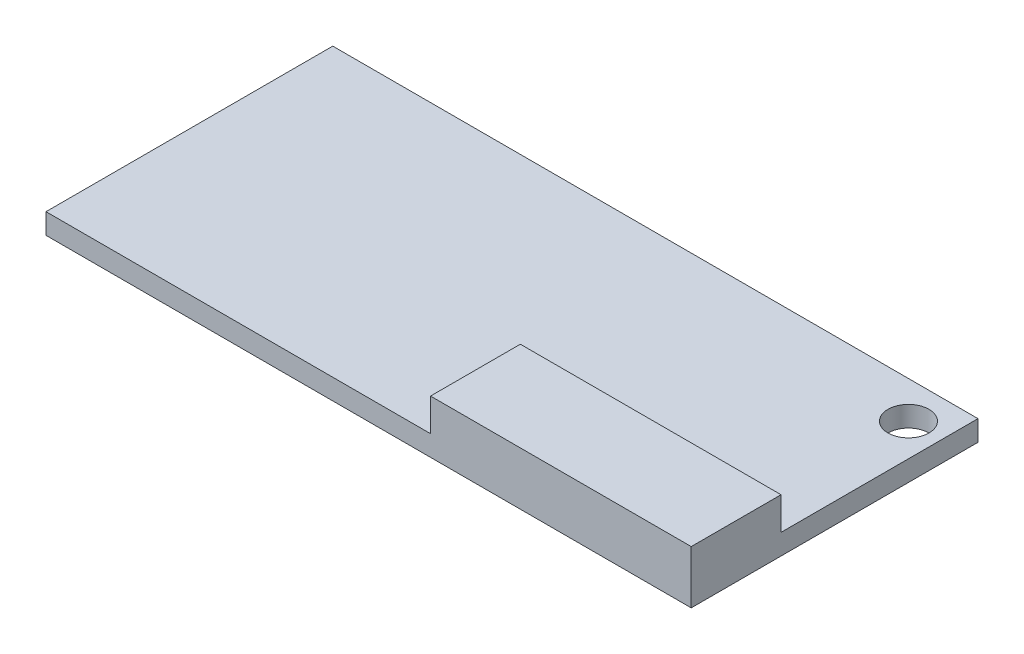
from build123d import *

# Parameters (mm, degrees)
SKETCH1_W           = 50.292
SKETCH1_H           = 22.352
SKETCH1_R           = 1.6
BOSS_EXTRUDE1_DEPTH = 1.6
SKETCH2_W           = 20.32
SKETCH2_H           = 7
BOSS_EXTRUDE2_DEPTH = 2.54
SKETCH3_W           = 43.18
SKETCH3_H           = 7.62
BOSS_EXTRUDE3_DEPTH = 2.54


with BuildPart() as part:
    # Sketch1 → Boss-Extrude1 (new body)
    with BuildSketch(Plane(origin=(0, 0, 0), x_dir=(1, 0, 0), z_dir=(0, 1, 0))):
        Rectangle(SKETCH1_W, SKETCH1_H)
        with Locations((22.606, 8.296203057)):
            Circle(SKETCH1_R, mode=Mode.SUBTRACT)
    extrude(amount=BOSS_EXTRUDE1_DEPTH)

    # Sketch2 → Boss-Extrude2 (add)
    with BuildSketch(Plane(origin=(0, 1.6, 0), x_dir=(1, 0, 0), z_dir=(0, 1, 0))):
        with Locations((14.986, -7.676)):
            Rectangle(SKETCH2_W, SKETCH2_H)
    extrude(amount=BOSS_EXTRUDE2_DEPTH)

    # Sketch3 → Boss-Extrude3 (add)
    with BuildSketch(Plane.XZ):
        with Locations((-3.556, -7.366)):
            Rectangle(SKETCH3_W, SKETCH3_H)
    extrude(amount=BOSS_EXTRUDE3_DEPTH)


solid = part.part
